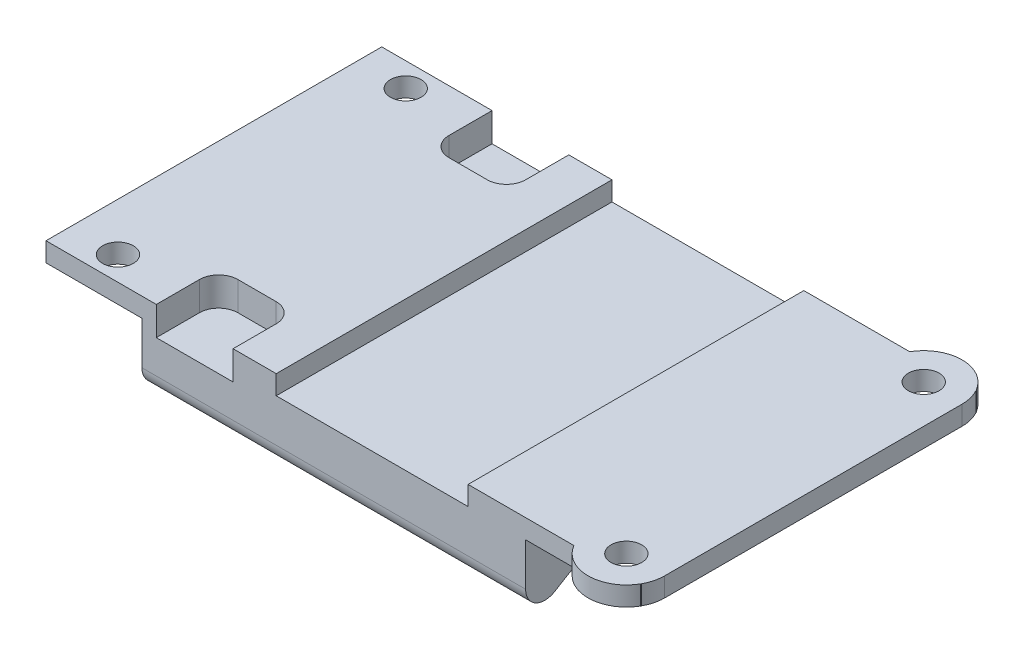
from build123d import *

# Parameters (mm, degrees)
SKETCH1_W               = 40
SKETCH1_H               = 35
BOSS_EXTRUDE1_DEPTH     = 10
CUT_EXTRUDE1_DEPTH      = 45.791182168
CUT_EXTRUDE1_DEPTH_BACK = 45.791182168
FILLET1_R               = 2
SKETCH4_W               = 35
SKETCH4_H               = 2
BOSS_EXTRUDE2_DEPTH     = 10
SKETCH5_W               = 35
SKETCH5_H               = 2
BOSS_EXTRUDE3_DEPTH     = 12
SKETCH6_R               = 1.6
CUT_EXTRUDE2_DEPTH      = 10
SKETCH7_W               = 8
SKETCH7_H               = 6.5
CUT_EXTRUDE3_DEPTH      = 3
SKETCH8_W               = 20
SKETCH8_H               = 2
CUT_EXTRUDE5_DEPTH      = 49.173650221
FILLET2_R               = 2
SKETCH10_R              = 1.6
CUT_EXTRUDE6_DEPTH      = 38.041599569
BOSS_EXTRUDE4_DEPTH     = 2


with BuildPart() as part:
    # Sketch1 → Boss-Extrude1 (new body)
    with BuildSketch(Plane(origin=(0, 0, 0), x_dir=(1, 0, 0), z_dir=(0, 1, 0))):
        Rectangle(SKETCH1_W, SKETCH1_H)
    extrude(amount=-BOSS_EXTRUDE1_DEPTH)

    # Sketch2 → Cut-Extrude1 (cut, two sides: drawn at the far end of the back side and taken through both)
    with BuildSketch(Plane(origin=(20, 0, 0), x_dir=(0, 0, -1), z_dir=(1, 0, 0)).offset(-CUT_EXTRUDE1_DEPTH_BACK)):
        Polygon((-12.5, -7), (-17.5, -10), (17.5, -10), (12.5, -7), align=None)
    extrude(amount=CUT_EXTRUDE1_DEPTH + CUT_EXTRUDE1_DEPTH_BACK, mode=Mode.SUBTRACT)

    # Fillet1
    fillet1_edges = [part.edges().sort_by_distance(p)[0] for p in [
        (0, -7, 12.5),
        (0, -7, -12.5),
        (0, -10, -17.5),
        (0, -10, 17.5),
    ]]
    fillet(fillet1_edges, radius=FILLET1_R)

    # Sketch4 → Boss-Extrude2 (add)
    with BuildSketch(Plane.ZY.offset(20)):
        with Locations((0, -1)):
            Rectangle(SKETCH4_W, SKETCH4_H)
    extrude(amount=BOSS_EXTRUDE2_DEPTH)

    # Sketch5 → Boss-Extrude3 (add)
    with BuildSketch(Plane(origin=(20, 0, 0), x_dir=(0, 0, -1), z_dir=(1, 0, 0))):
        with Locations((0, -1)):
            Rectangle(SKETCH5_W, SKETCH5_H)
    extrude(amount=BOSS_EXTRUDE3_DEPTH)

    # Sketch6 → Cut-Extrude2 (cut)
    with BuildSketch(Plane.XZ.offset(2)):
        with Locations((-25, 15)):
            Circle(SKETCH6_R)
        with Locations((-25, -15)):
            Circle(SKETCH6_R)
    extrude(amount=-CUT_EXTRUDE2_DEPTH, mode=Mode.SUBTRACT)

    # Sketch7 → Cut-Extrude3 (cut)
    with BuildSketch(Plane(origin=(0, 0, 0), x_dir=(1, 0, 0), z_dir=(0, 1, 0))):
        Polygon((-18.5, -19), (-10.5, -19), (-10.5, -11), (-18.5, -11), (-18.5, -15), align=None)
        with Locations((-14.5, 14.25)):
            Rectangle(SKETCH7_W, SKETCH7_H)
    extrude(amount=-CUT_EXTRUDE3_DEPTH, mode=Mode.SUBTRACT)

    # Sketch8 → Cut-Extrude5 (cut, through all)
    with BuildSketch(Plane.XY.offset(17.5)):
        with Locations((4, -1)):
            Rectangle(SKETCH8_W, SKETCH8_H)
    extrude(amount=-CUT_EXTRUDE5_DEPTH, mode=Mode.SUBTRACT)

    # Fillet2
    fillet2_edges = [part.edges().sort_by_distance(p)[0] for p in [
        (-18.5, -1.5, 11),
        (-10.5, -1.5, 11),
        (-18.5, -1.5, -11),
        (-10.5, -1.5, -11),
    ]]
    fillet(fillet2_edges, radius=FILLET2_R)

    # Sketch10 → Cut-Extrude6 (cut, through all)
    with BuildSketch(Plane.XZ.offset(2)):
        with Locations((28.5, 15.5)):
            Circle(SKETCH10_R)
        with Locations((28.5, -15.5)):
            Circle(SKETCH10_R)
    extrude(amount=-CUT_EXTRUDE6_DEPTH, mode=Mode.SUBTRACT)

    # Sketch10<4> → Boss-Extrude4 (add)
    with BuildSketch(Plane.XZ.offset(2)):
        with BuildLine():
            Line((32.5, -15.5), (32.5, 15.5))
            ThreePointArc((32.5, 15.5), (32.372983346, 16.5), (32, 17.436491673))
            Line((32, 17.436491673), (32, -17.436491673))
            ThreePointArc((32, -17.436491673), (32.372983346, -16.5), (32.5, -15.5))
        make_face()
        with BuildLine():
            Line((31.964101615, -17.5), (25.035898385, -17.5))
            ThreePointArc((25.035898385, -17.5), (28.5, -19.5), (31.964101615, -17.5))
        make_face()
        with BuildLine():
            ThreePointArc((31.964101615, 17.5), (28.5, 19.5), (25.035898385, 17.5))
            Line((25.035898385, 17.5), (31.964101615, 17.5))
        make_face()
    extrude(amount=-BOSS_EXTRUDE4_DEPTH)


solid = part.part
